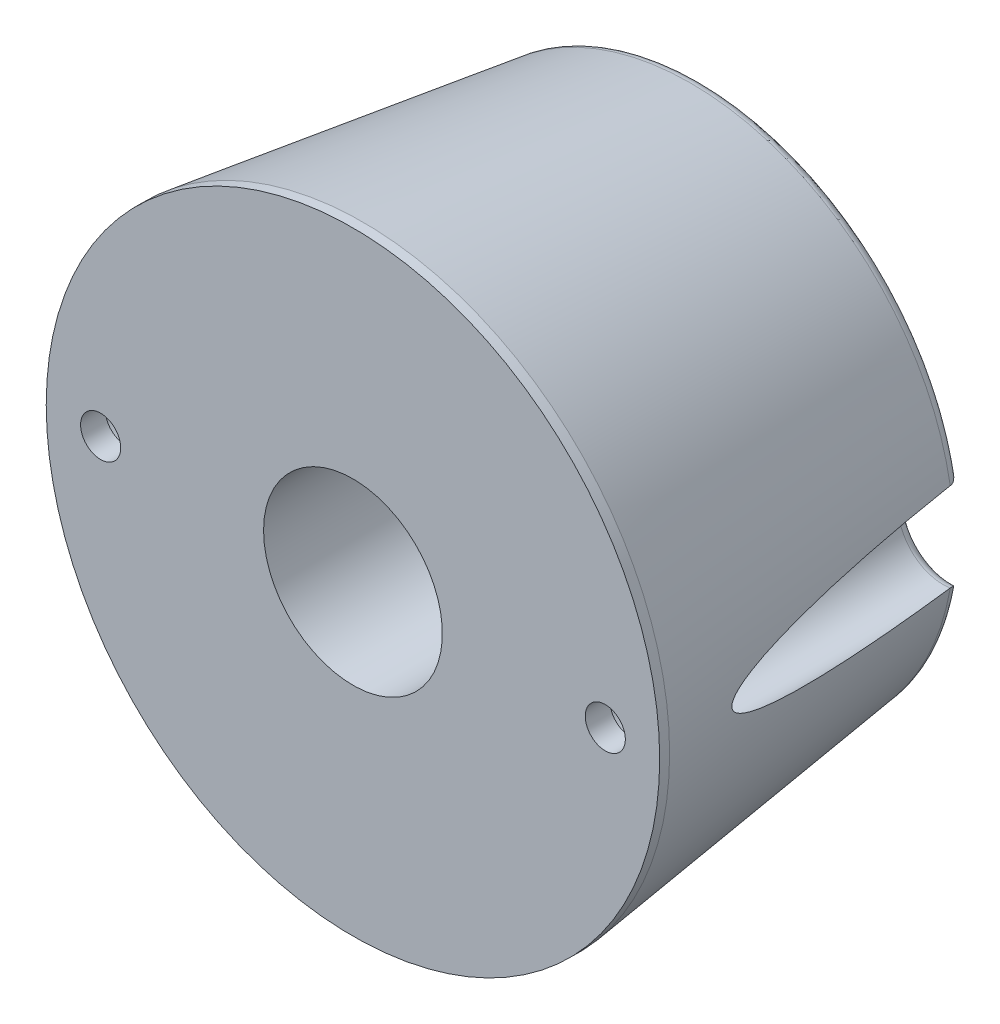
from build123d import *

# Parameters (mm, degrees)
SKETCH1_R           = 26.5
SKETCH1_R_2         = 1.5
BOSS_EXTRUDE1_DEPTH = 1
SKETCH2_R           = 30.877
BOSS_EXTRUDE2_DEPTH = 1
CUT_EXTRUDE1_START  = 5
SKETCH1_5_R         = 1.5
CUT_EXTRUDE1_DEPTH  = 5
CUT_EXTRUDE2_DEPTH  = 56.34237319
CUT_EXTRUDE3_DEPTH  = 32.5
SKETCH4_R           = 9
CUT_EXTRUDE4_DEPTH  = 56.962293291
FILLET1_R           = 1
BOSS_EXTRUDE3_START = -5
SKETCH5_R           = 9
SKETCH5_R_2         = 6.5
BOSS_EXTRUDE3_DEPTH = 2


with BuildPart() as part:
    # Sketch1 → Boss-Extrude1 (new body)
    with BuildSketch(Plane.XY):
        Circle(SKETCH1_R)
        with Locations((-15.35, -15.5)):
            Circle(SKETCH1_R_2, mode=Mode.SUBTRACT)
        with Locations((15.35, -15.5)):
            Circle(SKETCH1_R_2, mode=Mode.SUBTRACT)
        with Locations((15.35, 15.5)):
            Circle(SKETCH1_R_2, mode=Mode.SUBTRACT)
        with Locations((-15.35, 15.5)):
            Circle(SKETCH1_R_2, mode=Mode.SUBTRACT)
    extrude(amount=-BOSS_EXTRUDE1_DEPTH)



with BuildPart() as body_2:
    # Sketch2 → Boss-Extrude2 (new body)
    with BuildSketch(Plane.XY.offset(33)):
        Circle(SKETCH2_R)
        with BuildLine():
            ThreePointArc((27.4193, 0), (25.4, 2.0193), (23.3807, 0))
            ThreePointArc((23.3807, 0), (25.4, -2.0193), (27.4193, 0))
        make_face(mode=Mode.SUBTRACT)
        with BuildLine():
            ThreePointArc((-23.3807, 0), (-25.4, 2.0193), (-27.4193, 0))
            ThreePointArc((-27.4193, 0), (-25.4, -2.0193), (-23.3807, 0))
        make_face(mode=Mode.SUBTRACT)
    extrude(amount=BOSS_EXTRUDE2_DEPTH)


with BuildPart() as part_1:
    add(part.part)

    add(body_2.part)  # loft1 joins it to this body
    # loft up to a face of the part (loft1)
    loft([Face(Wire([part_1.edges().sort_by_distance((-18.140498307, 19.317668627, 0))[0]])), Face(Wire([part_1.edges().sort_by_distance((-21.13676099, -22.508364309, 33))[0]]))])

    # Sketch1<5> → Cut-Extrude1 (cut)
    with BuildSketch(Plane.XY.offset(CUT_EXTRUDE1_START)):
        with Locations((15.35, 15.5)):
            Circle(SKETCH1_5_R)
        with Locations((-15.35, 15.5)):
            Circle(SKETCH1_5_R)
        with Locations((-15.35, -15.5)):
            Circle(SKETCH1_5_R)
        with Locations((15.35, -15.5)):
            Circle(SKETCH1_5_R)
    extrude(amount=-CUT_EXTRUDE1_DEPTH, mode=Mode.SUBTRACT)

    # Sketch2<6> → Cut-Extrude2 (cut, through all)
    with BuildSketch(Plane.XY.offset(33)):
        with BuildLine():
            ThreePointArc((27.4193, 0), (25.4, 2.0193), (23.3807, 0))
            ThreePointArc((23.3807, 0), (25.4, -2.0193), (27.4193, 0))
        make_face()
        with BuildLine():
            ThreePointArc((-23.3807, 0), (-25.4, 2.0193), (-27.4193, 0))
            ThreePointArc((-27.4193, 0), (-25.4, -2.0193), (-23.3807, 0))
        make_face()
    extrude(amount=-CUT_EXTRUDE2_DEPTH, mode=Mode.SUBTRACT)

    # Sketch3 → Cut-Extrude3 (cut)
    # profile 1 of 2: a face of its own
    with BuildSketch(Plane(origin=(0, 0, -1), x_dir=(-1, 0, 0), z_dir=(0, 0, -1))):
        with BuildLine():
            ThreePointArc((-27.735523845, -3.869030998), (-20.8807, 0), (-27.735523845, 3.869030998))
            ThreePointArc((-27.735523845, 3.869030998), (-29.9193, 0), (-27.735523845, -3.869030998))
        make_face()
        with BuildLine():
            ThreePointArc((-26.443551723, 1.728748765), (-27.4193, 0), (-26.443551723, -1.728748765))
            ThreePointArc((-26.443551723, -1.728748765), (-23.3807, 0), (-26.443551723, 1.728748765))
        make_face(mode=Mode.SUBTRACT)
    # profile 2 of 2: a face of its own
    with BuildSketch(Plane(origin=(0, 0, -1), x_dir=(-1, 0, 0), z_dir=(0, 0, -1))):
        with BuildLine():
            ThreePointArc((27.735523845, -3.869030998), (20.8807, 0), (27.735523845, 3.869030998))
            ThreePointArc((27.735523845, 3.869030998), (29.9193, 0), (27.735523845, -3.869030998))
        make_face()
    extrude(amount=-CUT_EXTRUDE3_DEPTH, mode=Mode.SUBTRACT)

    # Sketch4 → Cut-Extrude4 (cut, through all)
    with BuildSketch(Plane(origin=(0, 0, -1), x_dir=(-1, 0, 0), z_dir=(0, 0, -1))):
        Circle(SKETCH4_R)
    extrude(amount=-CUT_EXTRUDE4_DEPTH, mode=Mode.SUBTRACT)

    # Fillet1
    fillet1_edges = [part_1.edges().sort_by_distance(p)[0] for p in [
        (-20.8807, 0, -1),
        (0, 26.5, -1),
        (0, -26.5, -1),
        (20.8807, 0, -1),
    ]]
    fillet(fillet1_edges, radius=FILLET1_R - 0.0001)  # a hair under: the kernel refuses the full size


with BuildPart() as body_2_2:
    # Sketch5 → Boss-Extrude3 (new body)
    with BuildSketch(Plane(origin=(0, 0, -1), x_dir=(-1, 0, 0), z_dir=(0, 0, -1)).offset(BOSS_EXTRUDE3_START)):
        Circle(SKETCH5_R)
        Circle(SKETCH5_R_2, mode=Mode.SUBTRACT)
    extrude(amount=-BOSS_EXTRUDE3_DEPTH)


solid = Compound([part_1.part, body_2_2.part])
